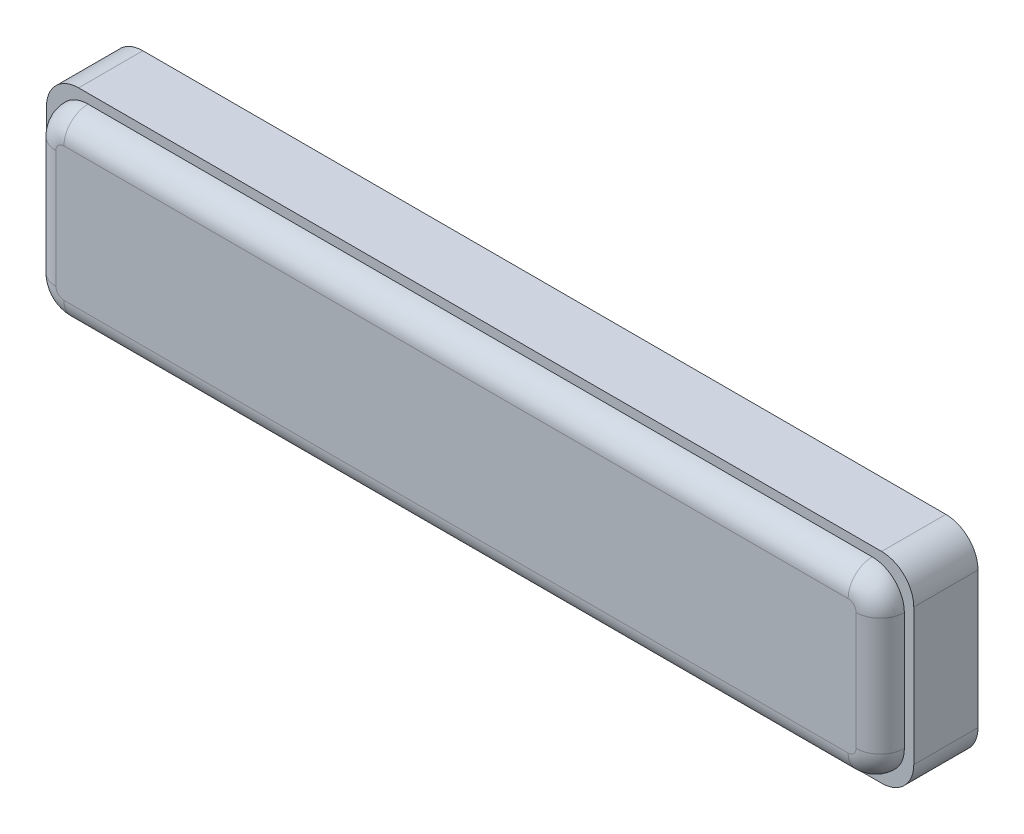
from build123d import *

# Parameters (mm, degrees)
EXTRUDE_1_DEPTH     = 8
SKETCH_2_R          = 7
SKETCH_2_R_2        = 3
SKETCH_2_R_3        = 0.840909091
SKETCH_2_R_4        = 0.720923158
CUT_EXTRUDE_1_DEPTH = 2
EXTRUDE_2_DEPTH     = 3
FILLET_1_R          = 3


with BuildPart() as part:
    # 스케치1 → 보스-돌출1 (new body)
    with BuildSketch(Plane.XY):
        with BuildLine():
            Line((-78.096917245, 13.340909091), (21.903082755, 13.340909091))
            ThreePointArc((21.903082755, 13.340909091), (24.73150988, 12.169336216), (25.903082755, 9.340909091))
            Line((25.903082755, 9.340909091), (25.903082755, -7.659090909))
            ThreePointArc((25.903082755, -7.659090909), (24.73150988, -10.487518034), (21.903082755, -11.659090909))
            Line((21.903082755, -11.659090909), (-78.096917245, -11.659090909))
            ThreePointArc((-78.096917245, -11.659090909), (-80.92534437, -10.487518034), (-82.096917245, -7.659090909))
            Line((-82.096917245, -7.659090909), (-82.096917245, 9.340909091))
            ThreePointArc((-82.096917245, 9.340909091), (-80.92534437, 12.169336216), (-78.096917245, 13.340909091))
        make_face()
    extrude(amount=EXTRUDE_1_DEPTH)

    # 스케치2 → 컷-돌출1 (cut)
    # profile 1 of 5: a face of its own
    with BuildSketch(Plane(origin=(0, 0, 0), x_dir=(-1, 0, 0), z_dir=(0, 0, -1))):
        with BuildLine():
            Line((-20.73150988, 12.169336216), (76.92534437, 12.169336216))
            ThreePointArc((76.92534437, 12.169336216), (79.753771494, 10.99776334), (80.92534437, 8.169336216))
            Line((80.92534437, 8.169336216), (80.92534437, -6.487518034))
            ThreePointArc((80.92534437, -6.487518034), (79.753771494, -9.315945159), (76.92534437, -10.487518034))
            Line((76.92534437, -10.487518034), (-20.73150988, -10.487518034))
            ThreePointArc((-20.73150988, -10.487518034), (-23.559937005, -9.315945159), (-24.73150988, -6.487518034))
            Line((-24.73150988, -6.487518034), (-24.73150988, 8.169336216))
            ThreePointArc((-24.73150988, 8.169336216), (-23.559937005, 10.99776334), (-20.73150988, 12.169336216))
        make_face()
        with BuildLine():
            ThreePointArc((4.235161258, 8.340909091), (-3.264838742, 0.840909091), (4.235161258, -6.659090909))
            Line((4.235161258, -6.659090909), (70.271722555, -6.659090909))
            ThreePointArc((70.271722555, -6.659090909), (77.771722555, 0.840909091), (70.271722555, 8.340909091))
            Line((70.271722555, 8.340909091), (4.235161258, 8.340909091))
        make_face(mode=Mode.SUBTRACT)
    # profile 2 of 5: a face of its own
    with BuildSketch(Plane(origin=(0, 0, 0), x_dir=(-1, 0, 0), z_dir=(0, 0, -1))):
        with Locations((4.235161258, 0.840909091)):
            Circle(SKETCH_2_R)
        with Locations((4.235161258, 0.840909091)):
            Circle(SKETCH_2_R_2, mode=Mode.SUBTRACT)
    # profile 3 of 5: a face of its own
    with BuildSketch(Plane(origin=(0, 0, 0), x_dir=(-1, 0, 0), z_dir=(0, 0, -1))):
        with Locations((70.271722555, 0.840909091)):
            Circle(SKETCH_2_R)
        with Locations((70.271722555, 0.840909091)):
            Circle(SKETCH_2_R_2, mode=Mode.SUBTRACT)
    # profile 4 of 5: a face of its own
    with BuildSketch(Plane(origin=(0, 0, 0), x_dir=(-1, 0, 0), z_dir=(0, 0, -1))):
        with Locations((70.271722555, 0.840909091)):
            Circle(SKETCH_2_R_3)
    # profile 5 of 5: a face of its own
    with BuildSketch(Plane(origin=(0, 0, 0), x_dir=(-1, 0, 0), z_dir=(0, 0, -1))):
        with Locations((4.235161258, 0.840909091)):
            Circle(SKETCH_2_R_4)
    extrude(amount=-CUT_EXTRUDE_1_DEPTH, mode=Mode.SUBTRACT)

    # 스케치3 → 보스-돌출2 (add)
    with BuildSketch(Plane.XY.offset(8)):
        with BuildLine():
            Line((-76.92534437, 12.169336216), (20.73150988, 12.169336216))
            ThreePointArc((20.73150988, 12.169336216), (23.559937005, 10.99776334), (24.73150988, 8.169336216))
            Line((24.73150988, 8.169336216), (24.73150988, -6.487518034))
            ThreePointArc((24.73150988, -6.487518034), (23.559937005, -9.315945159), (20.73150988, -10.487518034))
            Line((20.73150988, -10.487518034), (-76.92534437, -10.487518034))
            ThreePointArc((-76.92534437, -10.487518034), (-79.753771494, -9.315945159), (-80.92534437, -6.487518034))
            Line((-80.92534437, -6.487518034), (-80.92534437, 8.169336216))
            ThreePointArc((-80.92534437, 8.169336216), (-79.753771494, 10.99776334), (-76.92534437, 12.169336216))
        make_face()
    extrude(amount=EXTRUDE_2_DEPTH)

    # 필렛1
    fillet_1_edges = [part.edges().sort_by_distance(p)[0] for p in [
        (-28.096917245, -10.487518034, 11),
        (-79.753771494, -9.315945159, 11),
        (-80.92534437, 0.840909091, 11),
        (-79.753771494, 10.99776334, 11),
        (-28.096917245, 12.169336216, 11),
        (23.559937005, 10.99776334, 11),
        (24.73150988, 0.840909091, 11),
        (23.559937005, -9.315945159, 11),
    ]]
    fillet(fillet_1_edges, radius=FILLET_1_R - 0.0001)  # a hair under: the kernel refuses the full size


solid = part.part
